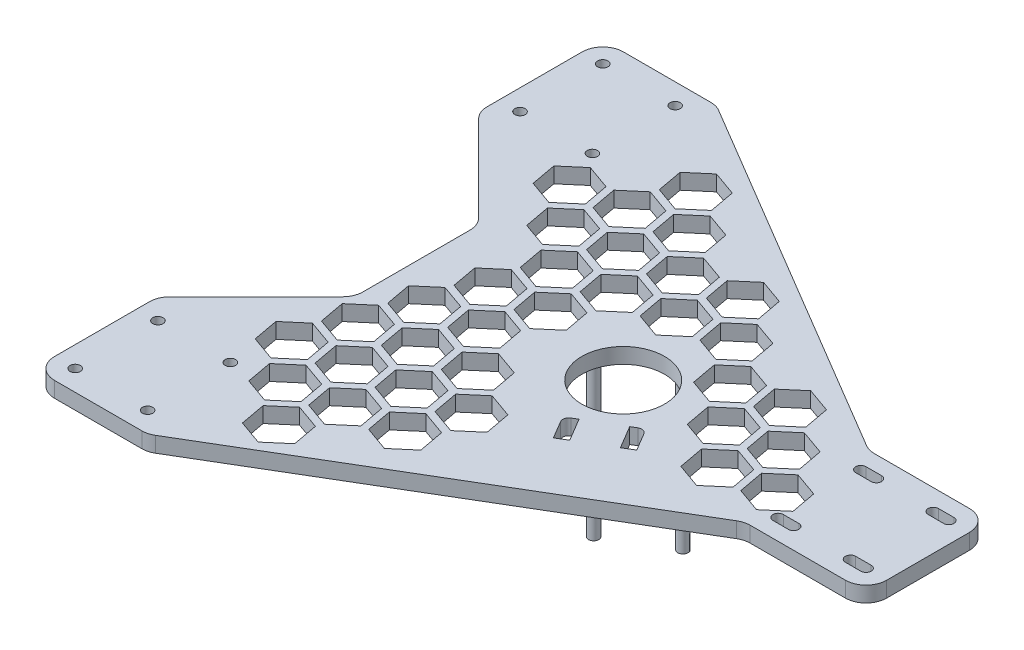
from build123d import *

# Parameters (mm, degrees)
ESQUISSE1_W             = 117.9
ESQUISSE1_H             = 110
BOSS_EXTRU_1_DEPTH      = 3
ESQUISSE2_R             = 1
ENL_V_MAT_EXTRU_1_DEPTH = 81.679009042
CONG_1_R                = 4
ESQUISSE3_R             = 8
ENL_V_MAT_EXTRU_2_DEPTH = 81.679009042
ENL_V_MAT_EXTRU_3_DEPTH = 81.679009042
ESQUISSE5_R             = 1
BOSS_EXTRU_2_DEPTH      = 30


with BuildPart() as part:
    # Esquisse1 → Boss.-Extru.1 (new body)
    with BuildSketch(Plane(origin=(0, 0, 0), x_dir=(1, 0, 0), z_dir=(0, 1, 0))):
        Rectangle(ESQUISSE1_W, ESQUISSE1_H)
    extrude(amount=BOSS_EXTRU_1_DEPTH)

    # Esquisse2 → Enlèv. mat.-Extru.1 (cut, through all)
    with BuildSketch(Plane(origin=(0, 0, 0), x_dir=(1, 0, 0), z_dir=(0, 1, 0))):
        with Locations((-40.95, -35)):
            Circle(ESQUISSE2_R)
        with Locations((-54.95, -35)):
            Circle(ESQUISSE2_R)
        with Locations((-54.95, -51)):
            Circle(ESQUISSE2_R)
        with Locations((-40.95, -51)):
            Circle(ESQUISSE2_R)
        with Locations((-40.95, 51)):
            Circle(ESQUISSE2_R)
        with Locations((-54.95, 51)):
            Circle(ESQUISSE2_R)
        with Locations((-54.95, 35)):
            Circle(ESQUISSE2_R)
        with Locations((-40.95, 35)):
            Circle(ESQUISSE2_R)
        Polygon((58.95, 12), (35.45, 12), (-36.95, 55), (58.95, 55), align=None)
        Polygon((58.95, -12), (35.45, -12), (-36.95, -55), (58.95, -55), align=None)
        Polygon((-58.95, -31), (-39.95, -12), (-39.95, 12), (-58.95, 31), align=None)
        with BuildLine():
            Line((37.95, 9), (40.95, 9))
            ThreePointArc((40.95, 9), (41.95, 8), (40.95, 7))
            Line((40.95, 7), (37.95, 7))
            ThreePointArc((37.95, 7), (36.95, 8), (37.95, 9))
        make_face()
        with BuildLine():
            Line((54.95, 7), (51.95, 7))
            ThreePointArc((51.95, 7), (50.95, 8), (51.95, 9))
            Line((51.95, 9), (54.95, 9))
            ThreePointArc((54.95, 9), (55.95, 8), (54.95, 7))
        make_face()
        with BuildLine():
            Line((37.95, -7), (40.95, -7))
            ThreePointArc((40.95, -7), (41.95, -8), (40.95, -9))
            Line((40.95, -9), (37.95, -9))
            ThreePointArc((37.95, -9), (36.95, -8), (37.95, -7))
        make_face()
        with BuildLine():
            Line((54.95, -9), (51.95, -9))
            ThreePointArc((51.95, -9), (50.95, -8), (51.95, -7))
            Line((51.95, -7), (54.95, -7))
            ThreePointArc((54.95, -7), (55.95, -8), (54.95, -9))
        make_face()
    extrude(amount=ENL_V_MAT_EXTRU_1_DEPTH, mode=Mode.SUBTRACT)

    # Congé1
    cong_1_edges = [part.edges().sort_by_distance(p)[0] for p in [
        (35.45, 1.5, 12),
        (58.95, 1.5, 12),
        (58.95, 1.5, -12),
        (35.45, 1.5, -12),
        (-36.95, 1.5, -55),
        (-58.95, 1.5, -55),
        (-58.95, 1.5, -31),
        (-39.95, 1.5, -12),
        (-39.95, 1.5, 12),
        (-58.95, 1.5, 31),
        (-58.95, 1.5, 55),
        (-36.95, 1.5, 55),
    ]]
    fillet(cong_1_edges, radius=CONG_1_R)

    # Esquisse3 → Enlèv. mat.-Extru.2 (cut, through all)
    with BuildSketch(Plane(origin=(0, 0, 0), x_dir=(1, 0, 0), z_dir=(0, 1, 0))):
        Circle(ESQUISSE3_R)
    extrude(amount=ENL_V_MAT_EXTRU_2_DEPTH, mode=Mode.SUBTRACT)

    # Esquisse4 → Enlèv. mat.-Extru.3 (cut, through all)
    with BuildSketch(Plane.XZ):
        with BuildLine():
            Line((2.902086692, 16.391282526), (0.859492683, 12.95212424))
            ThreePointArc((0.859492683, 12.95212424), (0.733847726, 12.080966442), (1.261004912, 11.376120455))
            Line((1.261004912, 11.376120455), (2.249762919, 10.788874678))
            Line((2.249762919, 10.788874678), (4.879602706, 15.21679097))
            Line((4.879602706, 15.21679097), (2.902086692, 16.391282526))
        make_face()
        with BuildLine():
            Line((8.397258355, 7.137737886), (11.027098142, 11.565654178))
            Line((11.027098142, 11.565654178), (13.004614156, 10.391162623))
            Line((13.004614156, 10.391162623), (10.962020146, 6.952004338))
            ThreePointArc((10.962020146, 6.952004338), (10.25717416, 6.424847152), (9.386016362, 6.550492108))
            Line((9.386016362, 6.550492108), (8.397258355, 7.137737886))
        make_face()
        Polygon((-20.80604881, -41.888381175), (-19.895996519, -36.971898202), (-23.698769526, -33.725528312), (-28.411594823, -35.395641396), (-29.321647114, -40.31212437), (-25.518874107, -43.558494259), align=None)
        Polygon((-24.226250243, -32.491454967), (-23.316197952, -27.574971994), (-27.118970959, -24.328602104), (-31.831796257, -25.998715188), (-32.741848548, -30.915198162), (-28.939075541, -34.161568051), align=None)
        Polygon((-27.646451676, -23.094528759), (-26.736399385, -18.178045786), (-30.539172392, -14.931675896), (-35.25199769, -16.60178898), (-36.162049981, -21.518271954), (-32.359276974, -24.764641843), align=None)
        Polygon((-14.378172713, -34.227936744), (-13.468120422, -29.31145377), (-17.270893429, -26.065083881), (-21.983718727, -27.735196965), (-22.893771017, -32.651679938), (-19.090998011, -35.898049828), align=None)
        Polygon((-17.804119321, -24.815225798), (-16.89406703, -19.898742825), (-20.696840037, -16.652372935), (-25.409665334, -18.322486019), (-26.319717625, -23.238968993), (-22.516944619, -26.485338882), align=None)
        Polygon((-34.074327773, -30.75497319), (-33.164275482, -25.838490217), (-36.967048489, -22.592120328), (-41.679873787, -24.262233412), (-42.589926078, -29.178716385), (-38.787153071, -32.425086274), align=None)
        Polygon((-11.376243224, -17.154781367), (-10.466190933, -12.238298394), (-14.26896394, -8.991928504), (-18.981789238, -10.662041588), (-19.891841528, -15.578524562), (-16.089068522, -18.824894451), align=None)
        Polygon((-21.224320754, -15.41829959), (-20.314268463, -10.501816617), (-24.11704147, -7.255446728), (-28.829866768, -8.925559812), (-29.739919059, -13.842042785), (-25.937146052, -17.088412674), align=None)
        Polygon((-24.638777013, -6.03715812), (-23.728724722, -1.120675147), (-27.531497729, 2.125694743), (-32.244323026, 0.455581659), (-33.154375317, -4.460901315), (-29.35160231, -7.707271204), align=None)
        Polygon((-14.790699483, -7.773639897), (-13.880647192, -2.857156923), (-17.683420198, 0.389212966), (-22.396245496, -1.280900118), (-23.306297787, -6.197383091), (-19.50352478, -9.443752981), align=None)
        Polygon((-18.210900916, 1.623286311), (-17.300848625, 6.539769284), (-21.103621632, 9.786139174), (-25.816446929, 8.11602609), (-26.72649922, 3.199543116), (-22.923726214, -0.046826773), align=None)
        Polygon((-21.631102349, 11.020212519), (-20.721050058, 15.936695492), (-24.523823065, 19.183065382), (-29.236648363, 17.512952298), (-30.146700654, 12.596469324), (-26.343927647, 9.350099435), align=None)
        Polygon((-25.051303782, 20.417138727), (-24.141251491, 25.3336217), (-27.944024498, 28.57999159), (-32.656849796, 26.909878506), (-33.566902087, 21.993395532), (-29.76412908, 18.747025643), align=None)
        Polygon((-28.471505216, 29.814064935), (-27.561452925, 34.730547908), (-31.364225932, 37.976917797), (-36.077051229, 36.306804713), (-36.98710352, 31.39032174), (-33.184330513, 28.143951851), align=None)
        Polygon((-28.058978446, 3.359768088), (-27.148926155, 8.276251061), (-30.951699162, 11.522620951), (-35.66452446, 9.852507866), (-36.57457675, 4.936024893), (-32.771803744, 1.689655004), align=None)
        Polygon((-15.203226252, 18.68065695), (-14.293173961, 23.597139923), (-18.095946968, 26.843509813), (-22.808772266, 25.173396729), (-23.718824557, 20.256913755), (-19.91605155, 17.010543866), align=None)
        Polygon((-8.775350155, 26.341101381), (-7.865297864, 31.257584355), (-11.668070871, 34.503954244), (-16.380896169, 32.83384116), (-17.29094846, 27.917358187), (-13.488175453, 24.670988297), align=None)
        Polygon((-18.623427685, 28.077583158), (-17.713375395, 32.994066131), (-21.516148401, 36.240436021), (-26.228973699, 34.570322937), (-27.13902599, 29.653839963), (-23.336252983, 26.407470074), align=None)
        Polygon((-22.043629119, 37.474509366), (-21.133576828, 42.390992339), (-24.936349835, 45.637362229), (-29.649175132, 43.967249145), (-30.559227423, 39.050766171), (-26.756454416, 35.804396282), align=None)
        Polygon((-34.899381312, 22.153620503), (-33.989329022, 27.070103477), (-37.792102028, 30.316473366), (-42.504927326, 28.646360282), (-43.414979617, 23.729877309), (-39.61220661, 20.483507419), align=None)
        Polygon((-31.479179879, 12.756694296), (-30.569127588, 17.673177269), (-34.371900595, 20.919547158), (-39.084725893, 19.249434074), (-39.994778184, 14.332951101), (-36.192005177, 11.086581212), align=None)
        Polygon((-11.783024819, 9.283730742), (-10.872972528, 14.200213716), (-14.675745535, 17.446583605), (-19.388570833, 15.776470521), (-20.298623123, 10.859987548), (-16.495850117, 7.613617658), align=None)
        Polygon((-7.956041791, -26.551707575), (-7.0459895, -21.635224601), (-10.848762507, -18.388854712), (-15.561587804, -20.058967796), (-16.471640095, -24.97545077), (-12.668867088, -28.221820659), align=None)
        Polygon((-1.528165694, -18.891263144), (-0.618113403, -13.97478017), (-4.42088641, -10.728410281), (-9.133711707, -12.398523365), (-10.043763998, -17.315006338), (-6.240990992, -20.561376228), align=None)
        Polygon((8.319911836, -20.62774492), (9.229964127, -15.711261947), (5.42719112, -12.464892058), (0.714365823, -14.135005142), (-0.195686468, -19.051488115), (3.607086539, -22.297858004), align=None)
        Polygon((14.747787933, -12.967300489), (15.657840224, -8.050817516), (11.855067217, -4.804447626), (7.14224192, -6.47456071), (6.232189629, -11.391043684), (10.034962635, -14.637413573), align=None)
        Polygon((21.17566403, -5.306856058), (22.085716321, -0.390373085), (18.282943314, 2.855996805), (13.570118016, 1.185883721), (12.660065725, -3.730599253), (16.462838732, -6.976969142), align=None)
        Polygon((27.603540127, 2.353588373), (28.513592418, 7.270071347), (24.710819411, 10.516441236), (19.997994113, 8.846328152), (19.087941822, 3.929845179), (22.890714829, 0.683475289), align=None)
        Polygon((24.595865463, -14.703782266), (25.505917754, -9.787299292), (21.703144747, -6.540929403), (16.99031945, -8.211042487), (16.080267159, -13.12752546), (19.883040166, -16.37389535), align=None)
        Polygon((31.02374156, -7.043337835), (31.933793851, -2.126854861), (28.131020844, 1.119515028), (23.418195547, -0.550598056), (22.508143256, -5.467081029), (26.310916262, -8.713450919), align=None)
        Polygon((37.451617657, 0.617106597), (38.361669948, 5.53358957), (34.558896941, 8.779959459), (29.846071643, 7.109846375), (28.936019352, 2.193363402), (32.738792359, -1.053006487), align=None)
        Polygon((-5.355148722, 16.944175173), (-4.445096431, 21.860658147), (-8.247869438, 25.107028036), (-12.960694736, 23.436914952), (-13.870747027, 18.520431979), (-10.06797402, 15.274062089), align=None)
        Polygon((1.892035739, -28.288189352), (2.80208803, -23.371706378), (-1.000684977, -20.125336489), (-5.713510274, -21.795449573), (-6.623562565, -26.711932546), (-2.820789558, -29.958302436), align=None)
    extrude(amount=-ENL_V_MAT_EXTRU_3_DEPTH, mode=Mode.SUBTRACT)

    # Esquisse5 → Boss.-Extru.2 (add)
    with BuildSketch(Plane.XZ):
        with Locations((-9.672655136, -3.948798447)):
            Circle(ESQUISSE5_R)
        with Locations((1.160693464, -10.382969577)):
            Circle(ESQUISSE5_R)
    extrude(amount=BOSS_EXTRU_2_DEPTH)


solid = part.part
